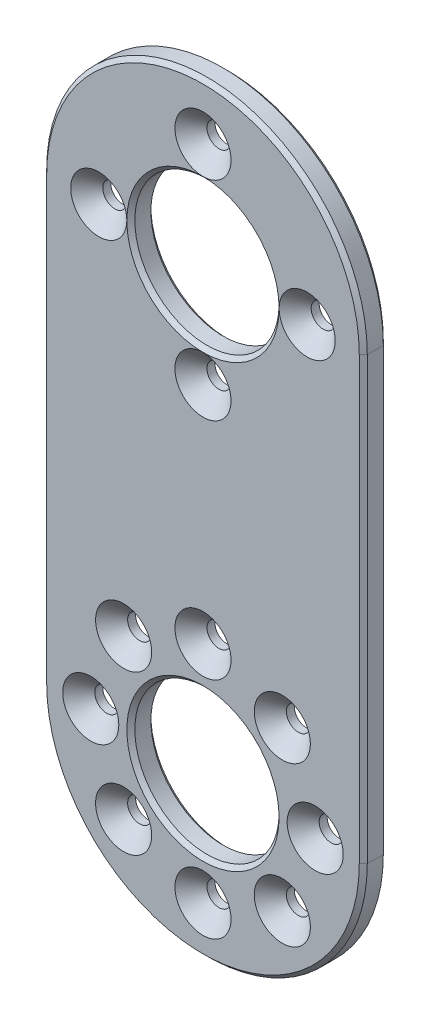
from build123d import *

# Parameters (mm, degrees)
ESQUISSE1_R      = 9
ESQUISSE1_R_2    = 1.5
EXTRUSION1_DEPTH = 3
CHANFREIN1_SIZE  = 2
CHANFREIN2_SIZE  = 0.5


with BuildPart() as part:
    # Esquisse1 → Extrusion1 (new body)
    with BuildSketch(Plane.XY):
        with BuildLine():
            Line((0, 0), (0, 55))
            ThreePointArc((0, 55), (20, 75), (40, 55))
            Line((40, 55), (40, 0))
            ThreePointArc((40, 0), (20, -20), (0, 0))
        make_face()
        with Locations((20, 55)):
            Circle(ESQUISSE1_R, mode=Mode.SUBTRACT)
        with Locations((20, 0)):
            Circle(ESQUISSE1_R, mode=Mode.SUBTRACT)
        with Locations((20, 68)):
            Circle(ESQUISSE1_R_2, mode=Mode.SUBTRACT)
        with Locations(Location((20, 42, 0), (0, 0, 180))):
            Circle(ESQUISSE1_R_2, mode=Mode.SUBTRACT)
        with Locations((7, 55)):
            Circle(ESQUISSE1_R_2, mode=Mode.SUBTRACT)
        with Locations(Location((33, 55, 0), (0, 0, 180))):
            Circle(ESQUISSE1_R_2, mode=Mode.SUBTRACT)
        with Locations((10.100505063, 9.899494937)):
            Circle(ESQUISSE1_R_2, mode=Mode.SUBTRACT)
        with Locations((6, 0)):
            Circle(ESQUISSE1_R_2, mode=Mode.SUBTRACT)
        with Locations((10.100505063, -9.899494937)):
            Circle(ESQUISSE1_R_2, mode=Mode.SUBTRACT)
        with Locations((20, -14)):
            Circle(ESQUISSE1_R_2, mode=Mode.SUBTRACT)
        with Locations((29.899494937, -9.899494937)):
            Circle(ESQUISSE1_R_2, mode=Mode.SUBTRACT)
        with Locations((34, 0)):
            Circle(ESQUISSE1_R_2, mode=Mode.SUBTRACT)
        with Locations((29.899494937, 9.899494937)):
            Circle(ESQUISSE1_R_2, mode=Mode.SUBTRACT)
        with Locations((20, 14)):
            Circle(ESQUISSE1_R_2, mode=Mode.SUBTRACT)
    extrude(amount=EXTRUSION1_DEPTH)

    # Chanfrein1
    chanfrein1_edges = [part.edges().sort_by_distance(p)[0] for p in [
        (18.5, 68, 3),
        (21.5, 42, 3),
        (5.5, 55, 3),
        (34.5, 55, 3),
        (8.600505063, 9.899494937, 3),
        (4.5, 0, 3),
        (8.600505063, -9.899494937, 3),
        (18.5, -14, 3),
        (28.399494937, -9.899494937, 3),
        (32.5, 0, 3),
        (28.399494937, 9.899494937, 3),
        (18.5, 14, 3),
    ]]
    chamfer(chanfrein1_edges, length=CHANFREIN1_SIZE)

    # Chanfrein2
    chanfrein2_edges = [part.edges().sort_by_distance(p)[0] for p in [
        (20, 75, 3),
        (11, 55, 0),
        (11, 55, 3),
        (0, 27.5, 3),
        (11, 0, 0),
        (11, 0, 3),
        (20, -20, 3),
        (0, 27.5, 0),
        (20, 75, 0),
        (40, 27.5, 0),
        (20, -20, 0),
        (40, 27.5, 3),
    ]]
    chamfer(chanfrein2_edges, length=CHANFREIN2_SIZE - 0.0001)  # a hair under: the kernel refuses the full size


solid = part.part
